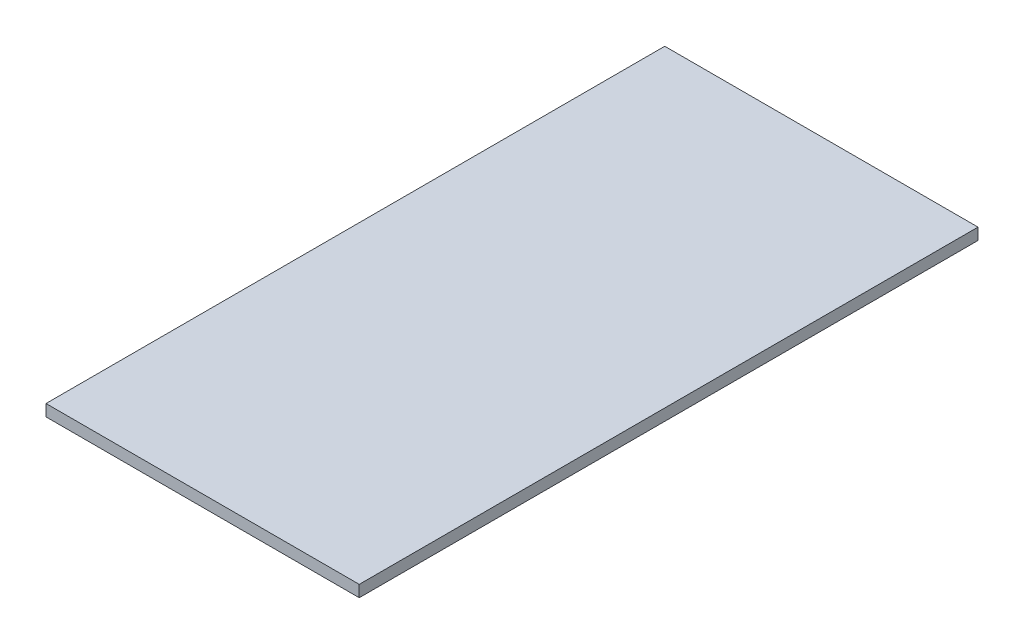
from build123d import *

# Parameters (mm, degrees)
SKETCH_1_W      = 81
SKETCH_1_H      = 160
EXTRUDE_1_DEPTH = 3


with BuildPart() as part:
    # 스케치1 → 보스-돌출1 (new body)
    with BuildSketch(Plane(origin=(0, 0, 0), x_dir=(1, 0, 0), z_dir=(0, 1, 0))):
        Rectangle(SKETCH_1_W, SKETCH_1_H)
    extrude(amount=EXTRUDE_1_DEPTH)


solid = part.part
